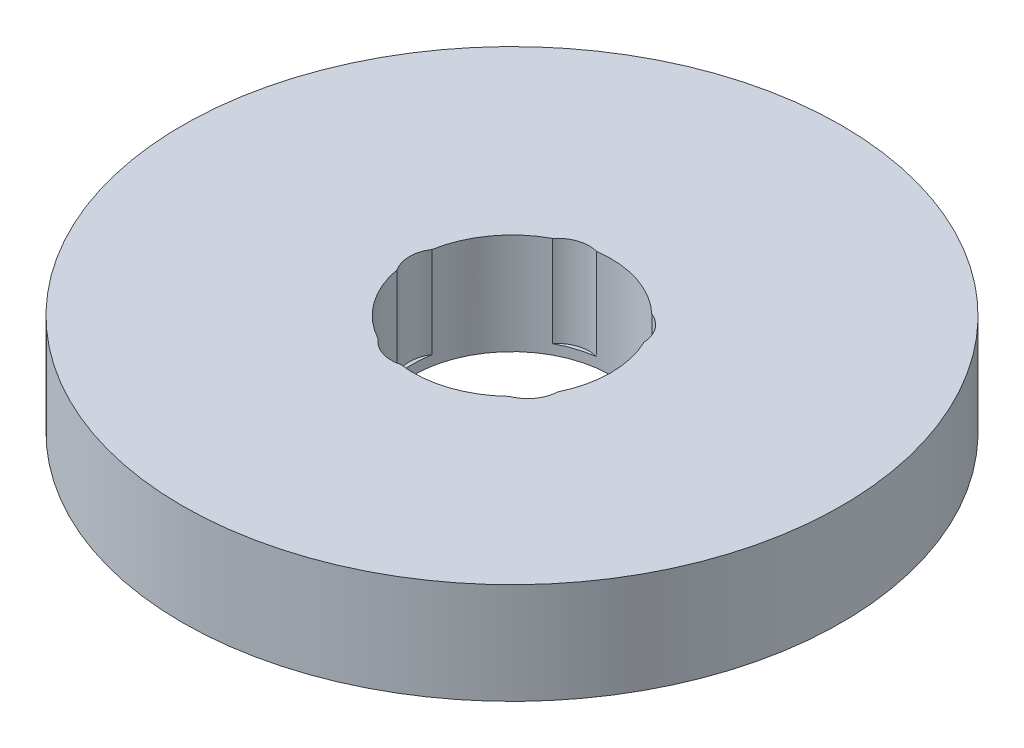
from build123d import *

# Parameters (mm, degrees)
SKETCH1_R           = 75
BOSS_EXTRUDE1_DEPTH = 23
SKETCH2_R           = 22.5
CUT_EXTRUDE1_DEPTH  = 109.531101533
SKETCH3_R           = 7.314483775
CUT_EXTRUDE2_DEPTH  = 20.74002555
CIRPATTERN1_COUNT   = 5


with BuildPart() as part:
    # Sketch1 → Boss-Extrude1 (new body)
    with BuildSketch(Plane(origin=(0, 0, 0), x_dir=(1, 0, 0), z_dir=(0, 1, 0))):
        Circle(SKETCH1_R)
    extrude(amount=BOSS_EXTRUDE1_DEPTH)

    # Sketch2 → Cut-Extrude1 (cut, through all)
    with BuildSketch(Plane(origin=(0, 0, 0), x_dir=(1, 0, 0), z_dir=(0, 1, 0))):
        Circle(SKETCH2_R)
    extrude(amount=CUT_EXTRUDE1_DEPTH, mode=Mode.SUBTRACT)

    # Sketch3 → Cut-Extrude2 (cut)
    with BuildSketch(Plane(origin=(0, 23, 0), x_dir=(1, 0, 0), z_dir=(0, 1, 0))):
        with Locations((-16.00655725, 0)):
            Circle(SKETCH3_R)
    cut_extrude2 = extrude(amount=-CUT_EXTRUDE2_DEPTH, mode=Mode.SUBTRACT)

    # CirPattern1: Cut-Extrude2 ×5 about axis
    cirpattern1_axis = Axis((0, 0, 0), (0, 1, 0))
    for i in range(1, CIRPATTERN1_COUNT):
        add(cut_extrude2.rotate(cirpattern1_axis, i * 360 / CIRPATTERN1_COUNT), mode=Mode.SUBTRACT)


solid = part.part
